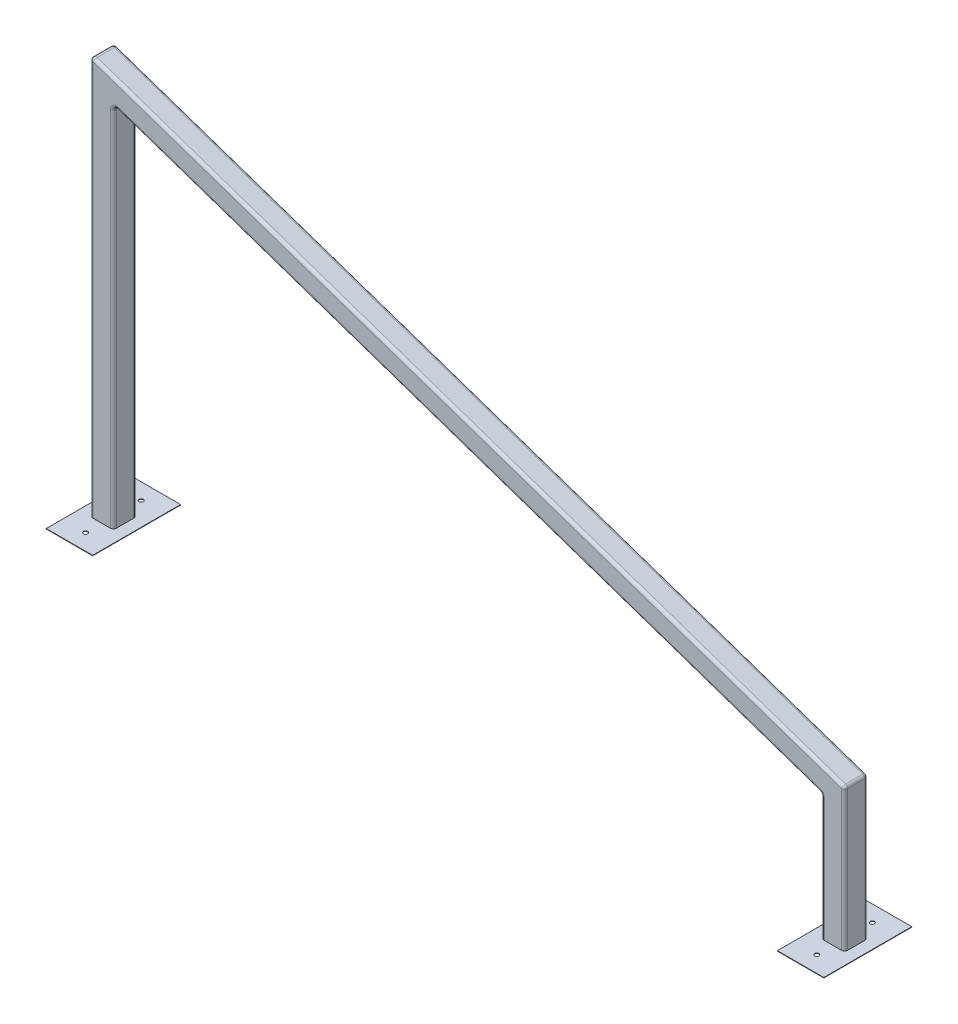
from build123d import *

# Parameters (mm, degrees)
SALIENTE_EXTRUIR1_DEPTH = 19.05
CROQUIS3_W              = 76
CROQUIS3_H              = 144
CROQUIS3_R              = 3.5
SALIENTE_EXTRUIR2_DEPTH = 0.75
REDONDEO1_R             = 5


with BuildPart() as part:
    # Croquis1 → Saliente-Extruir1 (new, symmetric)
    with BuildSketch(Plane.XY):
        Polygon((19.05, 0), (19.05, 600.762305609), (1178.076295057, 205.733417241), (1178.076295057, 0), (1216.176295057, 0), (1216.176295057, 233), (-19.05, 654), (-19.05, 0), align=None)
    extrude(amount=SALIENTE_EXTRUIR1_DEPTH, both=True)

    # Croquis3 → Saliente-Extruir2 (add)
    # profile 1 of 2: a face of its own
    with BuildSketch(Plane.XZ):
        Rectangle(CROQUIS3_W, CROQUIS3_H)
        with Locations((0, 45.525)):
            Circle(CROQUIS3_R, mode=Mode.SUBTRACT)
        with Locations((0, -45.525)):
            Circle(CROQUIS3_R, mode=Mode.SUBTRACT)
    # profile 2 of 2: a face of its own
    with BuildSketch(Plane.XZ):
        with Locations((1197.126295057, 0)):
            Rectangle(CROQUIS3_W, CROQUIS3_H)
        with Locations((1197.126295057, 45.525)):
            Circle(CROQUIS3_R, mode=Mode.SUBTRACT)
        with Locations((1197.126295057, -45.525)):
            Circle(CROQUIS3_R, mode=Mode.SUBTRACT)
    extrude(amount=SALIENTE_EXTRUIR2_DEPTH)

    # Redondeo1
    redondeo1_edges = [part.edges().sort_by_distance(p)[0] for p in [
        (19.05, 300.381152804, 19.05),
        (1178.076295057, 205.733417241, 0),
        (19.05, 600.762305609, 0),
        (-19.05, 654, 0),
        (1216.176295057, 233, 0),
        (1216.176295057, 116.5, 19.05),
        (1178.076295057, 102.866708621, 19.05),
        (1216.176295057, 116.5, -19.05),
        (1178.076295057, 102.866708621, -19.05),
        (598.563147528, 403.247861425, -19.05),
        (598.563147528, 443.5, -19.05),
        (598.563147528, 403.247861425, 19.05),
        (598.563147528, 443.5, 19.05),
        (-19.05, 327, 19.05),
        (-19.05, 327, -19.05),
        (19.05, 300.381152804, -19.05),
    ]]
    fillet(redondeo1_edges, radius=REDONDEO1_R)


solid = part.part
